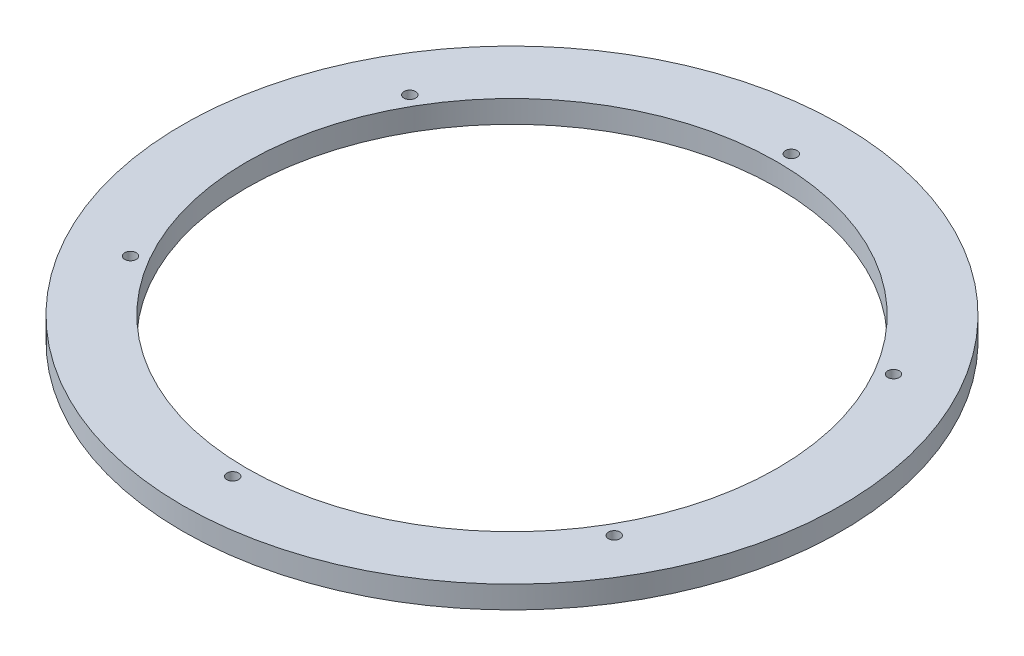
from build123d import *

# Parameters (mm, degrees)
SKETCH1_R           = 74.93
SKETCH1_R_2         = 1.3208
SKETCH1_R_3         = 60.325
BOSS_EXTRUDE1_DEPTH = 5.08


with BuildPart() as part:
    # Sketch1 → Boss-Extrude1 (new body)
    with BuildSketch(Plane(origin=(0, 0, 0), x_dir=(1, 0, 0), z_dir=(0, 1, 0))):
        Circle(SKETCH1_R)
        with Locations((0, 63.5)):
            Circle(SKETCH1_R_2, mode=Mode.SUBTRACT)
        with Locations((-54.99261314, -31.75)):
            Circle(SKETCH1_R_2, mode=Mode.SUBTRACT)
        with Locations((0, -63.5)):
            Circle(SKETCH1_R_2, mode=Mode.SUBTRACT)
        with Locations((54.99261314, -31.75)):
            Circle(SKETCH1_R_2, mode=Mode.SUBTRACT)
        with Locations((-54.99261314, 31.75)):
            Circle(SKETCH1_R_2, mode=Mode.SUBTRACT)
        Circle(SKETCH1_R_3, mode=Mode.SUBTRACT)
        with Locations((54.99261314, 31.75)):
            Circle(SKETCH1_R_2, mode=Mode.SUBTRACT)
    extrude(amount=BOSS_EXTRUDE1_DEPTH)


solid = part.part
